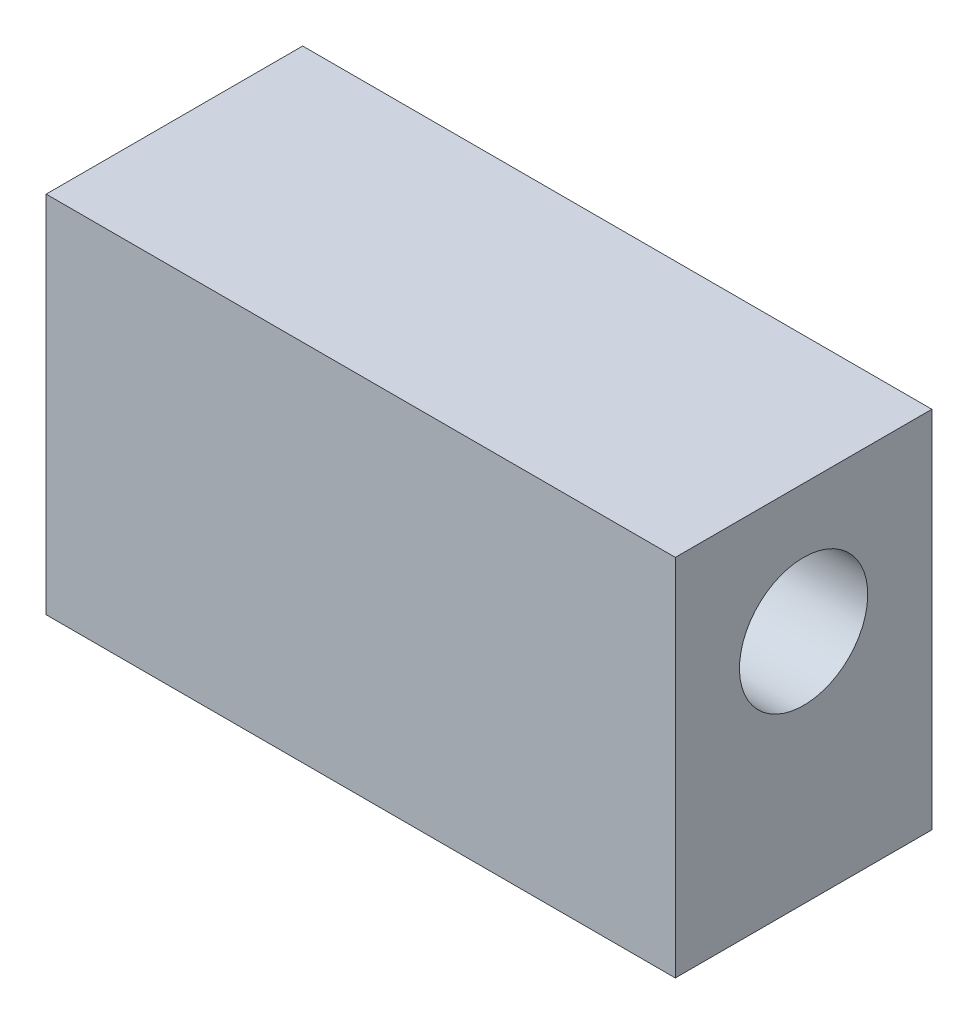
from build123d import *
from build123d.topology import SkipClean

# Parameters (mm, degrees)
SKETCH3_W                      = 31.148374891
SKETCH3_H                      = 19.837641971
BOSS_EXTRUDE1_DEPTH            = 6.35
SKETCH4_R                      = 3.175
CUT_EXTRUDE1_DEPTH             = 9.525
SKETCH5_R                      = 3.175
CUT_EXTRUDE5_DEPTH             = 9.525
CUT_EXTRUDE5_DIRECTION_2_REACH = 33.299
SKETCH6_R                      = 3.175
CUT_EXTRUDE6_DEPTH             = 9.525
SKETCH8_W                      = 12.7
SKETCH8_H                      = 1.803641971
CUT_EXTRUDE7_DEPTH             = 38.470999417


with BuildPart() as part:
    # Sketch3 → Boss-Extrude1 (new, symmetric)
    with BuildSketch(Plane.XY):
        with Locations((15.574187446, -9.918820986)):
            Rectangle(SKETCH3_W, SKETCH3_H)
    extrude(amount=BOSS_EXTRUDE1_DEPTH, both=True)

    # Sketch4 → Cut-Extrude1 (cut)
    with BuildSketch(Plane.ZY):
        with Locations((0, -6.35)):
            Circle(SKETCH4_R)
    cut_extrude1 = extrude(amount=-CUT_EXTRUDE1_DEPTH, mode=Mode.SUBTRACT)

    # Sketch5 → Cut-Extrude5 (cut)
    with BuildSketch(Plane(origin=(7.787093723, -19.837641971, 0), x_dir=(-0.8660254037844382, 0.500000000000001, 0), z_dir=(-0.500000000000001, -0.8660254037844382, 0))):
        Circle(SKETCH5_R)
    cut_extrude5 = extrude(amount=-CUT_EXTRUDE5_DEPTH, mode=Mode.SUBTRACT)

    # Sketch5 → Cut-Extrude5 direction 2 (cut, up to next)
    with BuildSketch(Plane(origin=(7.787093723, -19.837641971, 0), x_dir=(-0.8660254037844382, 0.500000000000001, 0), z_dir=(-0.500000000000001, -0.8660254037844382, 0)), mode=Mode.PRIVATE) as cut_extrude5_direction_2_sk1:
        Circle(SKETCH5_R)
    cut_extrude5_direction_2_tool1 = extrude(cut_extrude5_direction_2_sk1.sketch, amount=CUT_EXTRUDE5_DIRECTION_2_REACH, mode=Mode.PRIVATE) & part.part
    cut_extrude5_direction_2 = cut_extrude5_direction_2_tool1.solids().sort_by_distance((7.787094, -19.837642, 0))[0]
    add(cut_extrude5_direction_2, mode=Mode.SUBTRACT)

    # Sketch6 → Cut-Extrude6 (cut)
    with BuildSketch(Plane(origin=(0, 0, -6.35), x_dir=(-1, 0, 0), z_dir=(0, 0, -1))):
        with Locations((-15.574187445, -6.35)):
            Circle(SKETCH6_R)
    extrude(amount=-CUT_EXTRUDE6_DEPTH, mode=Mode.SUBTRACT)

    # Mirror1: Cut-Extrude1, Cut-Extrude5, Cut-Extrude5 direction 2 across plane
    with SkipClean():  # the faces are left unmerged after this step: merging them gives an invalid solid
        add(cut_extrude1.mirror(Plane.ZY.offset(-15.574187445)), mode=Mode.SUBTRACT)
        add(cut_extrude5.mirror(Plane.ZY.offset(-15.574187445)), mode=Mode.SUBTRACT)
        add(cut_extrude5_direction_2.mirror(Plane.ZY.offset(-15.574187445)), mode=Mode.SUBTRACT)

    # Sketch8 → Cut-Extrude7 (cut, through all)
    with BuildSketch(Plane(origin=(31.148374891, 0, 0), x_dir=(0, 0, -1), z_dir=(1, 0, 0))):
        with Locations((0, -18.935820986)):
            Rectangle(SKETCH8_W, SKETCH8_H)
    extrude(amount=-CUT_EXTRUDE7_DEPTH, mode=Mode.SUBTRACT)


solid = part.part
